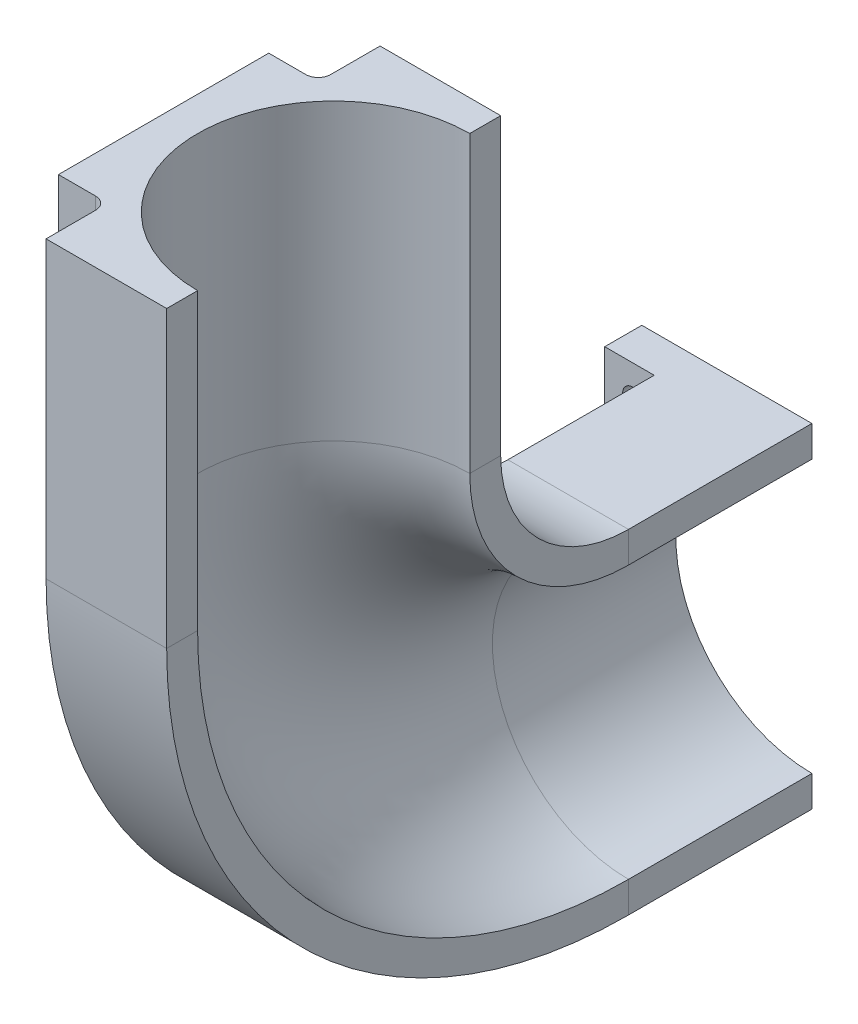
from build123d import *

# Parameters (mm, degrees)
EXTRUDE_1_DEPTH     = 6
SKETCH_4_R          = 1.6
CUT_EXTRUDE_1_DEPTH = 123.810830164


with BuildPart() as part:
    # 草图1 → 凸台-拉伸1 (new body)
    with BuildSketch(Plane.XY):
        with BuildLine():
            Line((0, 0), (27.5, 0))
            Line((27.5, 0), (27.5, -5))
            ThreePointArc((27.5, -5), (5.5, -27), (27.5, -49))
            Line((27.5, -49), (27.5, -54))
            Line((27.5, -54), (0, -54))
            Line((0, -54), (0, 0))
        make_face()
    extrude(amount=EXTRUDE_1_DEPTH)

    # 扫描1: sweep along a path in 草图3
    with BuildLine(Plane(origin=(27.5, 0, 0), x_dir=(0, 0, -1), z_dir=(1, 0, 0))) as sweep_1_path:
        Line((-6, -27), (-29.66, -27))
        ThreePointArc((-29.66, -27), (-63.360709191, -13.040709191), (-77.32, 20.66))
        Line((-77.32, 20.66), (-77.32, 68.26))
    # 草图2 → 扫描1 (sweep)
    with BuildSketch(Plane.XY.offset(6)):
        with BuildLine():
            Line((8, 0), (8, -8))
            ThreePointArc((8, -8), (7.414213562, -9.414213562), (6, -10))
            Line((6, -10), (0, -10))
            Line((0, -10), (0, -44))
            Line((0, -44), (6, -44))
            ThreePointArc((6, -44), (7.414213562, -44.585786438), (8, -46))
            Line((8, -46), (8, -54))
            Line((8, -54), (27.5, -54))
            Line((27.5, -54), (27.5, -49))
            ThreePointArc((27.5, -49), (5.5, -27), (27.5, -5))
            Line((27.5, -5), (27.5, 0))
            Line((27.5, 0), (8, 0))
        make_face()
    sweep(path=sweep_1_path.line)

    # 草图4 → 切除-拉伸1 (cut, through all)
    with BuildSketch(Plane.XY.offset(6)):
        with Locations((4.5, -5)):
            Circle(SKETCH_4_R)
    cut_extrude_1 = extrude(amount=-CUT_EXTRUDE_1_DEPTH, mode=Mode.SUBTRACT)

    # 镜向1: 切除-拉伸1 across plane
    add(cut_extrude_1.mirror(Plane.ZX.offset(-27)), mode=Mode.SUBTRACT)


solid = part.part
